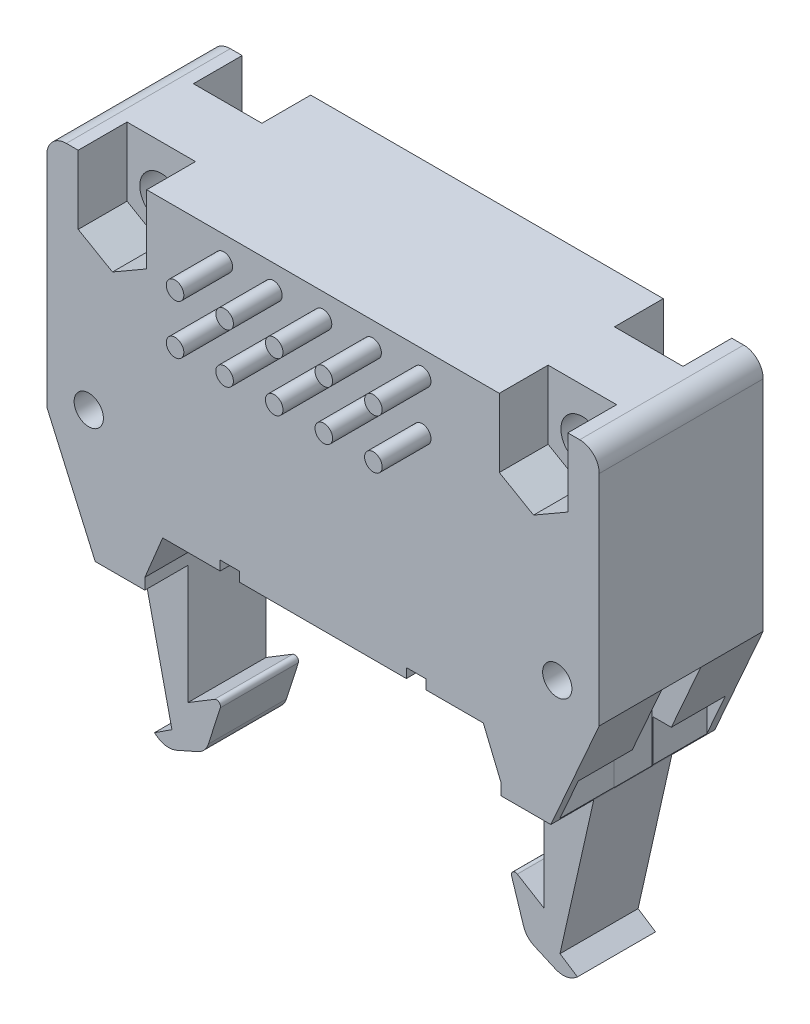
from build123d import *

# Parameters (mm, degrees)
EXTRUDE_1_DEPTH      = 8.4
SKETCH_2_W           = 3.875941336
SKETCH_2_H           = 10.635716013
CUT_EXTRUDE_1_DEPTH  = 150
SKETCH_3_W           = 2
SKETCH_3_H           = 5.614214587
CUT_EXTRUDE_2_DEPTH  = 2.5
SKETCH_4_W           = 7.533258122
SKETCH_4_H           = 2.2
CUT_EXTRUDE_3_DEPTH  = 2.45
SKETCH_5_W           = 2
SKETCH_5_H           = 5.614214587
CUT_EXTRUDE_4_DEPTH  = 2.5
SKETCH_6_W           = 2.766629061
SKETCH_6_H           = 2.133374911
CUT_EXTRUDE_5_DEPTH  = 2.45
SKETCH_7_W           = 16.422219314
SKETCH_7_H           = 5.5
CUT_EXTRUDE_6_DEPTH  = 10
SKETCH_8_R           = 0.45
EXTRUDE_2_DEPTH      = 8
SKETCH_9_R           = 1.1
SKETCH_9_R_2         = 0.75
SKETCH_9_W           = 1
SKETCH_9_H           = 0.97451262
CUT_EXTRUDE_7_DEPTH  = 10
SKETCH_10_W          = 16.251149316
SKETCH_10_H          = 2
CUT_EXTRUDE_8_DEPTH  = 2.5
CUT_EXTRUDE_9_DEPTH  = 2.5
SKETCH_12_W          = 4.6
SKETCH_12_H          = 9.297061896
CUT_EXTRUDE_10_DEPTH = 1.45
CHAMFER_1_SIZE       = 2
CUT_EXTRUDE_11_DEPTH = 0.2
SKETCH_14_R          = 0.45
EXTRUDE_3_DEPTH      = 2.5


with BuildPart() as part:
    # Эскиз1 → Вытянуть1 (new body)
    with BuildSketch(Plane.XY):
        with BuildLine():
            Line((-9.125, -11.858221261), (-8.211109657, -9.652950274))
            Line((-8.211109657, -9.652950274), (8.211109657, -9.652950274))
            Line((8.211109657, -9.652950274), (9.125, -11.858221261))
            Line((9.125, -11.858221261), (9.125, -18.516991449))
            Line((9.125, -18.516991449), (7.754731336, -17.684929687))
            ThreePointArc((7.754731336, -17.684929687), (7.527121952, -17.698805472), (7.460452641, -17.916873745))
            Line((7.460452641, -17.916873745), (8.074001716, -19.832909478))
            ThreePointArc((8.074001716, -19.832909478), (8.282801368, -20.196609982), (8.622375639, -20.442708876))
            Line((8.622375639, -20.442708876), (9.699802329, -20.918536331))
            ThreePointArc((9.699802329, -20.918536331), (10.213465399, -20.997740615), (10.697503229, -20.808451293))
            Line((10.697503229, -20.808451293), (10.834983302, -20.707015208))
            Line((10.834983302, -20.707015208), (9.939315034, -20.125628034))
            Line((9.939315034, -20.125628034), (11.669448618, -12.430286305))
            Line((11.669448618, -12.430286305), (14.148872473, -6.816071718))
            Line((14.148872473, -6.816071718), (14.148872473, 4.381463669))
            ThreePointArc((14.148872473, 4.381463669), (13.855979254, 5.08857045), (13.148872473, 5.381463669))
            Line((13.148872473, 5.381463669), (-13.148872473, 5.381463669))
            ThreePointArc((-13.148872473, 5.381463669), (-13.855979254, 5.08857045), (-14.148872473, 4.381463669))
            Line((-14.148872473, 4.381463669), (-14.148872473, -6.816071718))
            Line((-14.148872473, -6.816071718), (-11.669448618, -12.430286305))
            Line((-11.669448618, -12.430286305), (-9.939315034, -20.125628034))
            Line((-9.939315034, -20.125628034), (-10.834983302, -20.707015208))
            Line((-10.834983302, -20.707015208), (-10.697503229, -20.808451293))
            ThreePointArc((-10.697503229, -20.808451293), (-10.213465399, -20.997740615), (-9.699802329, -20.918536331))
            Line((-9.699802329, -20.918536331), (-8.622375639, -20.442708876))
            ThreePointArc((-8.622375639, -20.442708876), (-8.282801368, -20.196609982), (-8.074001716, -19.832909478))
            Line((-8.074001716, -19.832909478), (-7.460452641, -17.916873745))
            ThreePointArc((-7.460452641, -17.916873745), (-7.527121952, -17.698805472), (-7.754731336, -17.684929687))
            Line((-7.754731336, -17.684929687), (-9.125, -18.516991449))
            Line((-9.125, -18.516991449), (-9.125, -11.858221261))
        make_face()
    extrude(amount=EXTRUDE_1_DEPTH)

    # Эскиз2 → Вырез-Вытянуть1 (cut)
    with BuildSketch(Plane(origin=(14.148872473, 0, 0), x_dir=(0, 0, -1), z_dir=(1, 0, 0))):
        with Locations((-8.137970668, -17.748144312)):
            Rectangle(SKETCH_2_W, SKETCH_2_H)
        with Locations((-0.262029332, -17.748144312)):
            Rectangle(SKETCH_2_W, SKETCH_2_H)
    extrude(amount=-CUT_EXTRUDE_1_DEPTH, mode=Mode.SUBTRACT)

    # Эскиз3 → Вырез-Вытянуть2 (cut)
    with BuildSketch(Plane(origin=(14.148872473, 0, 0), x_dir=(0, 0, -1), z_dir=(1, 0, 0))):
        with Locations((-4.2, -9.623179012)):
            Rectangle(SKETCH_3_W, SKETCH_3_H)
    extrude(amount=-CUT_EXTRUDE_2_DEPTH, mode=Mode.SUBTRACT)

    # Эскиз4 → Вырез-Вытянуть3 (cut)
    with BuildSketch(Plane(origin=(14.148872473, 0, 0), x_dir=(0, 0, -1), z_dir=(1, 0, 0))):
        with Locations((-4.2, -11.330286305)):
            Rectangle(SKETCH_4_W, SKETCH_4_H)
    extrude(amount=-CUT_EXTRUDE_3_DEPTH, mode=Mode.SUBTRACT)

    # Эскиз5 → Вырез-Вытянуть4 (cut)
    with BuildSketch(Plane.ZY.offset(14.148872473)):
        with Locations((4.2, -9.623179012)):
            Rectangle(SKETCH_5_W, SKETCH_5_H)
    extrude(amount=-CUT_EXTRUDE_4_DEPTH, mode=Mode.SUBTRACT)

    # Эскиз6 → Вырез-Вытянуть5 (cut)
    with BuildSketch(Plane.ZY.offset(14.148872473)):
        with Locations((6.583314531, -11.296973761)):
            Rectangle(SKETCH_6_W, SKETCH_6_H)
        with Locations((1.81668547, -11.296973761)):
            Rectangle(SKETCH_6_W, SKETCH_6_H)
    extrude(amount=-CUT_EXTRUDE_5_DEPTH, mode=Mode.SUBTRACT)

    # Эскиз7 → Вырез-Вытянуть6 (cut)
    with BuildSketch(Plane.XZ.offset(9.652950274)):
        with Locations((0, 4.2)):
            Rectangle(SKETCH_7_W, SKETCH_7_H)
    extrude(amount=-CUT_EXTRUDE_6_DEPTH, mode=Mode.SUBTRACT)

    # Эскиз8 → Вытянуть2 (add)
    with BuildSketch(Plane.XZ.offset(-0.347049726)):
        with Locations(Location((0, 2.93, 0), (0, 0, 90))):
            Circle(SKETCH_8_R)
        with Locations(Location((0, 5.47, 0), (0, 0, 90))):
            Circle(SKETCH_8_R)
        with Locations(Location((2.54, 5.47, 0), (0, 0, 90))):
            Circle(SKETCH_8_R)
        with Locations(Location((2.54, 2.93, 0), (0, 0, 90))):
            Circle(SKETCH_8_R)
        with Locations(Location((5.08, 5.47, 0), (0, 0, 90))):
            Circle(SKETCH_8_R)
        with Locations(Location((5.08, 2.93, 0), (0, 0, 90))):
            Circle(SKETCH_8_R)
        with Locations(Location((-2.54, 5.47, 0), (0, 0, 90))):
            Circle(SKETCH_8_R)
        with Locations(Location((-2.54, 2.93, 0), (0, 0, 90))):
            Circle(SKETCH_8_R)
        with Locations(Location((-5.08, 5.47, 0), (0, 0, 90))):
            Circle(SKETCH_8_R)
        with Locations(Location((-5.08, 2.93, 0), (0, 0, 90))):
            Circle(SKETCH_8_R)
    extrude(amount=EXTRUDE_2_DEPTH)

    # Эскиз9 → Вырез-Вытянуть7 (cut)
    with BuildSketch(Plane(origin=(0, 0, 0), x_dir=(-1, 0, 0), z_dir=(0, 0, -1))):
        with Locations((-10.785, 2.881463669)):
            Circle(SKETCH_9_R)
        with Locations((10.785, 2.881463669)):
            Circle(SKETCH_9_R)
        with Locations((-12, -5.867574023)):
            Circle(SKETCH_9_R_2)
        with Locations(Location((12, -5.867574023, 0), (0, 0, 180))):
            Circle(SKETCH_9_R_2)
        with Locations((4.770217249, -9.651420054)):
            Rectangle(SKETCH_9_W, SKETCH_9_H)
        with Locations((-4.770217249, -9.651420054)):
            Rectangle(SKETCH_9_W, SKETCH_9_H)
    extrude(amount=-CUT_EXTRUDE_7_DEPTH, mode=Mode.SUBTRACT)

    # Эскиз10 → Вырез-Вытянуть8 (cut)
    with BuildSketch(Plane(origin=(0, 0, 0), x_dir=(-1, 0, 0), z_dir=(0, 0, -1))):
        Polygon((-12.539432173, 3.987610768), (-12.539432173, 6.55660708), (-9.030567827, 6.55660708), (-9.030567827, 3.987610768), (-9.030567827, 1.868541782), (-10.785, 0.855619895), (-12.539432173, 1.868541782), align=None)
        Polygon((9.030567827, 6.55660708), (9.030567827, 3.987610768), (9.030567827, 1.868541782), (10.785, 0.855619895), (12.539432173, 1.868541782), (12.539432173, 3.987610768), (12.539432173, 6.55660708), align=None)
        with Locations((0, 2.868541782)):
            Rectangle(SKETCH_10_W, SKETCH_10_H)
    extrude(amount=-CUT_EXTRUDE_8_DEPTH, mode=Mode.SUBTRACT)

    # Эскиз11 → Вырез-Вытянуть9 (cut)
    with BuildSketch(Plane.XY.offset(8.4)):
        Polygon((12.539432173, 1.868541782), (12.539432173, 5.381463669), (9.030567827, 5.381463669), (9.030567827, 1.868541782), (10.785, 0.855619895), align=None)
        Polygon((-9.030567827, 5.381463669), (-12.539432173, 5.381463669), (-12.539432173, 1.868541782), (-10.785, 0.855619895), (-9.030567827, 1.868541782), align=None)
    extrude(amount=-CUT_EXTRUDE_9_DEPTH, mode=Mode.SUBTRACT)

    # Эскиз12 → Вырез-Вытянуть10 (cut)
    with BuildSketch(Plane(origin=(0, 0, 0), x_dir=(-1, 0, 0), z_dir=(0, 0, -1))):
        with Locations((0, -6.301481222)):
            Rectangle(SKETCH_12_W, SKETCH_12_H)
    extrude(amount=-CUT_EXTRUDE_10_DEPTH, mode=Mode.SUBTRACT)

    # Фаска1
    # the kernel refuses this chamfer: 2 mm, written as the material it takes off along each edge
    with BuildSketch(Plane(origin=(-2.3, -1.652950274, 0), x_dir=(0, 0.9996219169112968, -0.027495876610586365), z_dir=(1, 0, 0))) as chamfer_1_piece_1:
        Polygon((CHAMFER_1_SIZE * 0.999621916911, CHAMFER_1_SIZE * 0.0274958766106), (-CHAMFER_1_SIZE * 0.0274958766106, CHAMFER_1_SIZE * 0.999621916911), (0, 0), align=None)
    extrude(amount=4.6, mode=Mode.SUBTRACT)

    # Эскиз13 → Вырез-Вытянуть11 (cut)
    with BuildSketch(Plane(origin=(0, 0, 0), x_dir=(-1, 0, 0), z_dir=(0, 0, -1))):
        Polygon((6.423321525, -9.652950274), (7.482877419, -9.652950274), (6.953099472, -8.645062752), align=None)
    extrude(amount=-CUT_EXTRUDE_11_DEPTH, mode=Mode.SUBTRACT)

    # Эскиз14 → Вытянуть3 (add)
    with BuildSketch(Plane.XY.offset(8.4)):
        with Locations((0, 4.151463669)):
            Circle(SKETCH_14_R)
        with Locations((0, 1.611463669)):
            Circle(SKETCH_14_R)
        with Locations((2.54, 4.151463669)):
            Circle(SKETCH_14_R)
        with Locations((2.54, 1.611463669)):
            Circle(SKETCH_14_R)
        with Locations((5.08, 4.151463669)):
            Circle(SKETCH_14_R)
        with Locations((5.08, 1.611463669)):
            Circle(SKETCH_14_R)
        with Locations((-2.54, 4.151463669)):
            Circle(SKETCH_14_R)
        with Locations((-2.54, 1.611463669)):
            Circle(SKETCH_14_R)
        with Locations((-5.08, 4.151463669)):
            Circle(SKETCH_14_R)
        with Locations((-5.08, 1.611463669)):
            Circle(SKETCH_14_R)
    extrude(amount=EXTRUDE_3_DEPTH)


solid = part.part
